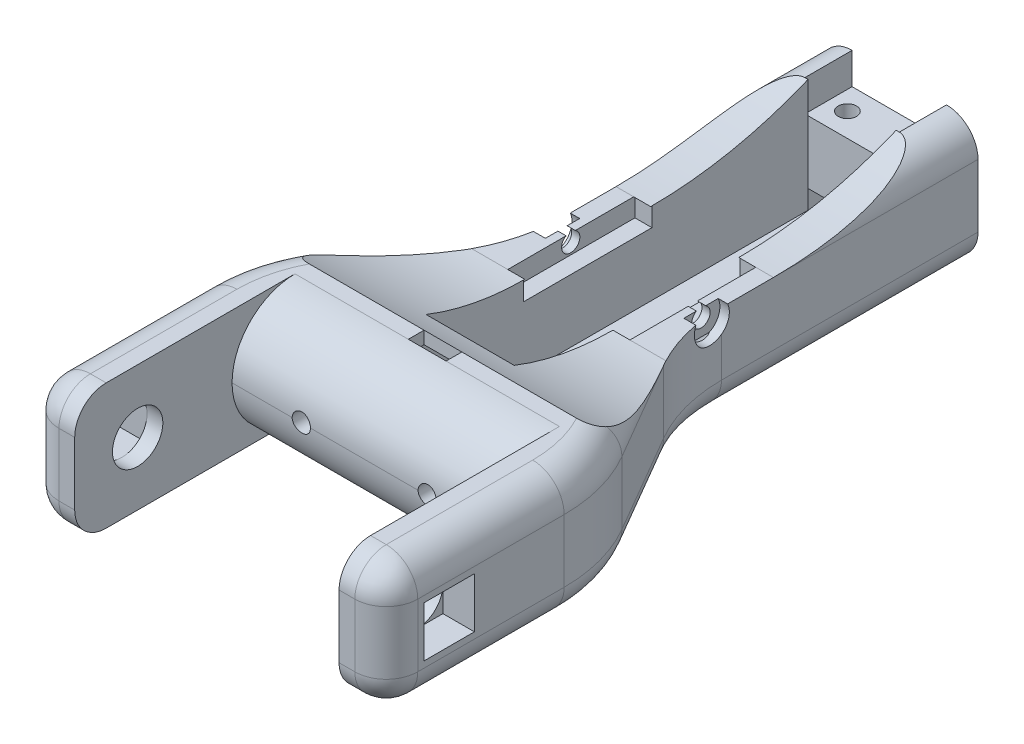
from build123d import *

# Parameters (mm, degrees)
EXTRUDE_1_DEPTH           = 20
SKETCH_2_R                = 4
CUT_EXTRUDE_1_DEPTH       = 52
FILLET_1_R                = 25
FILLET_2_R                = 5
FILLET_3_R                = 10
SKETCH_4_W                = 8
SKETCH_4_H                = 8
CUT_EXTRUDE_2_DEPTH       = 5
CUT_EXTRUDE_START         = -57
SKETCH_4_2_W              = 8
SKETCH_4_2_H              = 8
CUT_EXTRUDE_3_DEPTH       = 5
SKETCH_5_W                = 15
SKETCH_5_H                = 5
CUT_EXTRUDE_4_DEPTH       = 7.5
SKETCH_6_R                = 1.45
CUT_EXTRUDE_5_DEPTH       = 10
CUT_EXTRUDE_6_DEPTH       = 7
SKETCH_9_R                = 1.45
CUT_EXTRUDE_7_DEPTH       = 90
CUT_EXTRUDE_8_DEPTH       = 116.378724321
CUT_EXTRUDE_8_DEPTH_BACK  = 116.378724321
SKETCH_11_W               = 14
SKETCH_11_H               = 2
CUT_EXTRUDE_9_DEPTH       = 10
SKETCH_12_W               = 6
SKETCH_12_H               = 2.5
CUT_EXTRUDE_10_DEPTH      = 10
SKETCH_13_W               = 2.7
SKETCH_13_H               = 20.4
CUT_EXTRUDE_11_DEPTH      = 3
CUT_EXTRUDE_12_DEPTH      = 119.149227817
CUT_EXTRUDE_12_DEPTH_BACK = 119.149227817
SKETCH_14_R               = 1.45
CUT_EXTRUDE_13_DEPTH      = 120.084004107
CUT_EXTRUDE_13_DEPTH_BACK = 1.5
SKETCH_15_R               = 3
CUT_EXTRUDE_14_DEPTH      = 1.5
CUT_EXTRUDE_14_DEPTH_BACK = 120.084004107
CUT_EXTRUDE_14_START      = -25
SKETCH_15_2_R             = 3


with BuildPart() as part:
    # Эскиз1 → Бобышка-Вытянуть1 (new body)
    with BuildSketch(Plane(origin=(0, 0, 0), x_dir=(1, 0, 0), z_dir=(0, 1, 0))):
        Polygon((21, 25), (-21, 25), (-21, 0), (-28.5, 0), (-28.5, 35), (-12.5, 62.5), (-12.5, 110), (12.5, 110), (12.5, 62.5), (28.5, 35), (28.5, 0), (21, 0), align=None)
    extrude(amount=EXTRUDE_1_DEPTH)

    # Эскиз2 → Вырез-Вытянуть1 (cut)
    with BuildSketch(Plane(origin=(28.5, 0, 0), x_dir=(0, 0, -1), z_dir=(1, 0, 0))):
        with Locations((10, 10)):
            Circle(SKETCH_2_R)
    extrude(amount=-CUT_EXTRUDE_1_DEPTH, mode=Mode.SUBTRACT)

    # Скругление1
    fillet_1_edges = [part.edges().sort_by_distance(p)[0] for p in [
        (28.5, 10, -35),
        (-28.5, 10, -35),
        (-12.5, 10, -62.5),
        (12.5, 10, -62.5),
    ]]
    fillet(fillet_1_edges, radius=FILLET_1_R)

    # Скругление2
    fillet_2_edges = [part.edges().sort_by_distance(p)[0] for p in [
        (28.5, 0, -14.128221453),
        (24.75, 0, 0),
        (-24.75, 0, 0),
        (-12.5, 0, -89.621778547),
        (-12.5, 20, -89.621778547),
        (28.5, 10, 0),
        (-28.5, 10, 0),
        (-24.75, 20, 0),
        (24.75, 20, 0),
        (-28.5, 0, -14.128221453),
        (-28.5, 20, -14.128221453),
        (20.5, 0, -48.75),
        (-20.5, 0, -48.75),
        (12.5, 0, -89.621778547),
        (27.637291802, 0, -34.76729112),
        (-27.637291802, 0, -34.76729112),
        (28.5, 20, -14.128221453),
        (-20.5, 20, -48.75),
        (20.5, 20, -48.75),
        (12.5, 20, -89.621778547),
        (27.637291802, 20, -34.76729112),
        (-27.637291802, 20, -34.76729112),
        (-13.362708198, 0, -62.73270888),
        (-13.362708198, 20, -62.73270888),
        (13.362708198, 0, -62.73270888),
        (13.362708198, 20, -62.73270888),
    ]]
    fillet(fillet_2_edges, radius=FILLET_2_R)

    # Скругление3
    fillet_3_edges = [part.edges().sort_by_distance(p)[0] for p in [
        (0, 0, -25),
        (0, 20, -25),
    ]]
    fillet(fillet_3_edges, radius=FILLET_3_R - 0.0001)  # a hair under: the kernel refuses the full size

    # Эскиз4 → Вырез-Вытянуть2 (cut)
    with BuildSketch(Plane(origin=(28.5, 0, 0), x_dir=(0, 0, -1), z_dir=(1, 0, 0))):
        with Locations((10, 10)):
            Rectangle(SKETCH_4_W, SKETCH_4_H)
    extrude(amount=-CUT_EXTRUDE_2_DEPTH, mode=Mode.SUBTRACT)

    # Эскиз4<2> → Вырез-Вытянуть3 (cut)
    with BuildSketch(Plane(origin=(28.5, 0, 0), x_dir=(0, 0, -1), z_dir=(1, 0, 0)).offset(CUT_EXTRUDE_START)):
        with Locations((10, 10)):
            Rectangle(SKETCH_4_2_W, SKETCH_4_2_H)
    extrude(amount=CUT_EXTRUDE_3_DEPTH, mode=Mode.SUBTRACT)

    # Эскиз5 → Вырез-Вытянуть4 (cut)
    with BuildSketch(Plane(origin=(0, 0, -110), x_dir=(-1, 0, 0), z_dir=(0, 0, -1))):
        with Locations((0, 17.5)):
            Rectangle(SKETCH_5_W, SKETCH_5_H)
        with Locations((0, 2.5)):
            Rectangle(SKETCH_5_W, SKETCH_5_H)
    extrude(amount=-CUT_EXTRUDE_4_DEPTH, mode=Mode.SUBTRACT)

    # Эскиз6 → Вырез-Вытянуть5 (cut)
    with BuildSketch(Plane(origin=(0, 15, 0), x_dir=(1, 0, 0), z_dir=(0, 1, 0))):
        with Locations(Location((-4.5, 106.25, 0), (0, 0, 270))):
            Circle(SKETCH_6_R)
        with Locations(Location((4.5, 106.25, 0), (0, 0, 90))):
            Circle(SKETCH_6_R)
    extrude(amount=-CUT_EXTRUDE_5_DEPTH, mode=Mode.SUBTRACT)

    # Эскиз8 → Вырез-Вытянуть6 (cut, symmetric)
    with BuildSketch(Plane(origin=(0, 0, 0), x_dir=(0, 0, -1), z_dir=(1, 0, 0))):
        with BuildLine():
            Line((102.5, 18), (37.5, 18))
            ThreePointArc((37.5, 18), (29.5, 10), (37.5, 2))
            Line((37.5, 2), (102.5, 2))
            Line((102.5, 2), (102.5, 18))
        make_face()
    extrude(amount=CUT_EXTRUDE_6_DEPTH, both=True, mode=Mode.SUBTRACT)

    # Эскиз9 → Вырез-Вытянуть7 (cut)
    with BuildSketch(Plane(origin=(0, 0, -110), x_dir=(-1, 0, 0), z_dir=(0, 0, -1))):
        with Locations((-10, 10)):
            Circle(SKETCH_9_R)
        with Locations((10, 10)):
            Circle(SKETCH_9_R)
    extrude(amount=-CUT_EXTRUDE_7_DEPTH, mode=Mode.SUBTRACT)

    # Эскиз10 → Вырез-Вытянуть8 (cut, two sides: drawn at the far end of the back side and taken through both)
    with BuildSketch(Plane(origin=(0, 0, 0), x_dir=(0, 0, -1), z_dir=(1, 0, 0)).offset(-CUT_EXTRUDE_8_DEPTH_BACK)):
        with BuildLine():
            Line((37.5, 20), (102.5, 20))
            ThreePointArc((102.5, 20), (90.247548784, 16.26225608), (77.5, 15))
            Line((77.5, 15), (57.5, 15))
            ThreePointArc((57.5, 15), (47.192235936, 16.268943744), (37.5, 20))
        make_face()
    extrude(amount=CUT_EXTRUDE_8_DEPTH + CUT_EXTRUDE_8_DEPTH_BACK, mode=Mode.SUBTRACT)

    # Эскиз11 → Вырез-Вытянуть9 (cut)
    with BuildSketch(Plane(origin=(0, 0, -102.5), x_dir=(-1, 0, 0), z_dir=(0, 0, -1))):
        with Locations((0, 19)):
            Rectangle(SKETCH_11_W, SKETCH_11_H)
    extrude(amount=-CUT_EXTRUDE_9_DEPTH, mode=Mode.SUBTRACT)

    # Эскиз12 → Вырез-Вытянуть10 (cut)
    with BuildSketch(Plane(origin=(0, 20, 0), x_dir=(1, 0, 0), z_dir=(0, 1, 0))):
        with Locations((0, 36.25)):
            Rectangle(SKETCH_12_W, SKETCH_12_H)
    extrude(amount=-CUT_EXTRUDE_10_DEPTH, mode=Mode.SUBTRACT)

    # Эскиз13 → Вырез-Вытянуть11 (cut)
    with BuildSketch(Plane(origin=(0, 15, 0), x_dir=(1, 0, 0), z_dir=(0, 1, 0))):
        with Locations((8.35, 67.5)):
            Rectangle(SKETCH_13_W, SKETCH_13_H)
        with Locations((-8.35, 67.5)):
            Rectangle(SKETCH_13_W, SKETCH_13_H)
    extrude(amount=-CUT_EXTRUDE_11_DEPTH, mode=Mode.SUBTRACT)

    # Эскиз14 → Вырез-Вытянуть12 (cut, two sides: drawn at the far end of the back side and taken through both)
    with BuildSketch(Plane(origin=(-9.7, 0, 0), x_dir=(0, 0, -1), z_dir=(1, 0, 0)).offset(-CUT_EXTRUDE_12_DEPTH_BACK)):
        with Locations((67.5, 13.75)):
            Circle(SKETCH_14_R)
    extrude(amount=CUT_EXTRUDE_12_DEPTH + CUT_EXTRUDE_12_DEPTH_BACK, mode=Mode.SUBTRACT)

    # Эскиз15 → Вырез-Вытянуть13 (cut, two sides: drawn at the far end of the back side and taken through both)
    with BuildSketch(Plane(origin=(12.5, 0, 0), x_dir=(0, 0, -1), z_dir=(1, 0, 0)).offset(-CUT_EXTRUDE_13_DEPTH_BACK)):
        with Locations((67.5, 13.75)):
            Circle(SKETCH_15_R)
    extrude(amount=CUT_EXTRUDE_13_DEPTH + CUT_EXTRUDE_13_DEPTH_BACK, mode=Mode.SUBTRACT)

    # Эскиз15<2> → Вырез-Вытянуть14 (cut, two sides: drawn at the far end of the back side and taken through both)
    with BuildSketch(Plane(origin=(12.5, 0, 0), x_dir=(0, 0, -1), z_dir=(1, 0, 0)).offset(CUT_EXTRUDE_14_START - CUT_EXTRUDE_14_DEPTH_BACK)):
        with Locations((67.5, 13.75)):
            Circle(SKETCH_15_2_R)
    extrude(amount=CUT_EXTRUDE_14_DEPTH + CUT_EXTRUDE_14_DEPTH_BACK, mode=Mode.SUBTRACT)


solid = part.part
